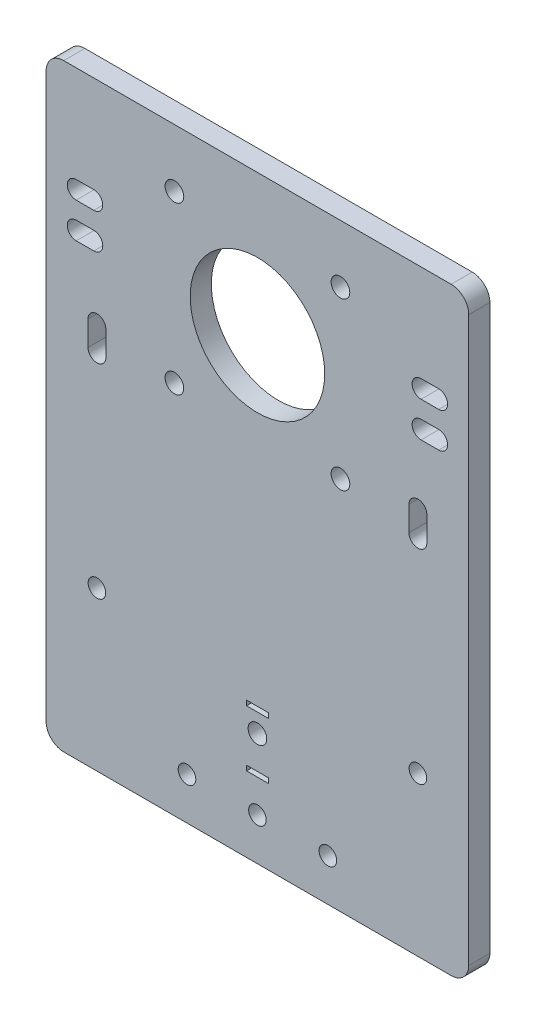
from build123d import *

# Parameters (mm, degrees)
BOSS_EXTRUDE1_DEPTH      = 6
SKETCH3_R                = 19.1
CUT_EXTRUDE1_DEPTH       = 6
M5_CLEARANCE_HOLE1_D     = 5.3
CUT_EXTRUDE2_DEPTH       = 6
CUT_EXTRUDE4_DEPTH       = 6
F_5_0_5_DIAMETER_HOLE4_D = 5
M5_CLEARANCE_HOLE2_D     = 5.3
M5_CLEARANCE_HOLE2_DEPTH = 10
M5_CLEARANCE_HOLE2_TIP   = 1.59228064
SKETCH21_W               = 6.2
SKETCH21_H               = 1.4
CUT_EXTRUDE5_DEPTH       = 6
SKETCH22_W               = 6.2
SKETCH22_H               = 1.4
CUT_EXTRUDE6_DEPTH       = 10


with BuildPart() as part:
    # Sketch1 → Boss-Extrude1 (new body)
    with BuildSketch(Plane.XY):
        with BuildLine():
            Line((-55, -85), (55, -85))
            ThreePointArc((55, -85), (58.535533906, -83.535533906), (60, -80))
            Line((60, -80), (60, 80))
            ThreePointArc((60, 80), (58.535533906, 83.535533906), (55, 85))
            Line((55, 85), (-55, 85))
            ThreePointArc((-55, 85), (-58.535533906, 83.535533906), (-60, 80))
            Line((-60, 80), (-60, -80))
            ThreePointArc((-60, -80), (-58.535533906, -83.535533906), (-55, -85))
        make_face()
    extrude(amount=BOSS_EXTRUDE1_DEPTH)

    # Sketch3 → Cut-Extrude1 (cut)
    with BuildSketch(Plane.XY.offset(6)):
        with Locations((0, 45)):
            Circle(SKETCH3_R)
    extrude(amount=-CUT_EXTRUDE1_DEPTH, mode=Mode.SUBTRACT)

    # M5 Clearance Hole1 (through all)
    with Locations(Plane.XY.offset(6)):
        with Locations((-23.57, 68.57), (23.57, 68.57), (23.57, 21.43), (-23.57, 21.43)):
            Hole(M5_CLEARANCE_HOLE1_D / 2)

    # Sketch11 → Cut-Extrude2 (cut)
    with BuildSketch(Plane.XY.offset(6)):
        with BuildLine():
            Line((-43.03, 24.93), (-43.03, 17.93))
            ThreePointArc((-43.03, 17.93), (-45.57, 15.39), (-48.11, 17.93))
            Line((-48.11, 17.93), (-48.11, 24.93))
            ThreePointArc((-48.11, 24.93), (-45.57, 27.47), (-43.03, 24.93))
        make_face()
        with BuildLine():
            Line((43.03, 24.93), (43.03, 17.93))
            ThreePointArc((43.03, 17.93), (45.57, 15.39), (48.11, 17.93))
            Line((48.11, 17.93), (48.11, 24.93))
            ThreePointArc((48.11, 24.93), (45.57, 27.47), (43.03, 24.93))
        make_face()
    extrude(amount=-CUT_EXTRUDE2_DEPTH, mode=Mode.SUBTRACT)

    # Sketch15 → Cut-Extrude4 (cut)
    with BuildSketch(Plane.XY.offset(6)):
        with BuildLine():
            Line((-51.46, 47.54), (-46.46, 47.54))
            ThreePointArc((-46.46, 47.54), (-43.92, 45), (-46.46, 42.46))
            Line((-46.46, 42.46), (-51.46, 42.46))
            ThreePointArc((-51.46, 42.46), (-54, 45), (-51.46, 47.54))
        make_face()
        with BuildLine():
            Line((-51.46, 57.54), (-46.46, 57.54))
            ThreePointArc((-46.46, 57.54), (-43.92, 55), (-46.46, 52.46))
            Line((-46.46, 52.46), (-51.46, 52.46))
            ThreePointArc((-51.46, 52.46), (-54, 55), (-51.46, 57.54))
        make_face()
        with BuildLine():
            Line((51.46, 47.54), (46.46, 47.54))
            ThreePointArc((46.46, 47.54), (43.92, 45), (46.46, 42.46))
            Line((46.46, 42.46), (51.46, 42.46))
            ThreePointArc((51.46, 42.46), (54, 45), (51.46, 47.54))
        make_face()
        with BuildLine():
            Line((51.46, 57.54), (46.46, 57.54))
            ThreePointArc((46.46, 57.54), (43.92, 55), (46.46, 52.46))
            Line((46.46, 52.46), (51.46, 52.46))
            ThreePointArc((51.46, 52.46), (54, 55), (51.46, 57.54))
        make_face()
    extrude(amount=-CUT_EXTRUDE4_DEPTH, mode=Mode.SUBTRACT)

    # Ø5.0 (5) Diameter Hole4 (through all)
    with Locations(Plane.XY.offset(6)):
        with Locations((-45.57, -39.97), (45.57, -39.97), (20, -73), (0, -73), (-20, -73)):
            Hole(F_5_0_5_DIAMETER_HOLE4_D / 2)

    # M5 Clearance Hole2
    with Locations(Plane(origin=(0, 0, 0), x_dir=(-1, 0, 0), z_dir=(0, 0, -1))):
        with Locations((0, -53)):
            Hole(M5_CLEARANCE_HOLE2_D / 2, depth=M5_CLEARANCE_HOLE2_DEPTH)
            with Locations((0, 0, -(M5_CLEARANCE_HOLE2_DEPTH + M5_CLEARANCE_HOLE2_TIP / 2))):  # 118° drill point
                Cone(0, M5_CLEARANCE_HOLE2_D / 2, M5_CLEARANCE_HOLE2_TIP, mode=Mode.SUBTRACT)

    # Sketch21 → Cut-Extrude5 (cut)
    with BuildSketch(Plane(origin=(0, 0, 0), x_dir=(-1, 0, 0), z_dir=(0, 0, -1))):
        with Locations((0, -47)):
            Rectangle(SKETCH21_W, SKETCH21_H)
    extrude(amount=-CUT_EXTRUDE5_DEPTH, mode=Mode.SUBTRACT)

    # Sketch22 → Cut-Extrude6 (cut)
    with BuildSketch(Plane.XY.offset(6)):
        with Locations((0, -63)):
            Rectangle(SKETCH22_W, SKETCH22_H)
    extrude(amount=-CUT_EXTRUDE6_DEPTH, mode=Mode.SUBTRACT)


solid = part.part
